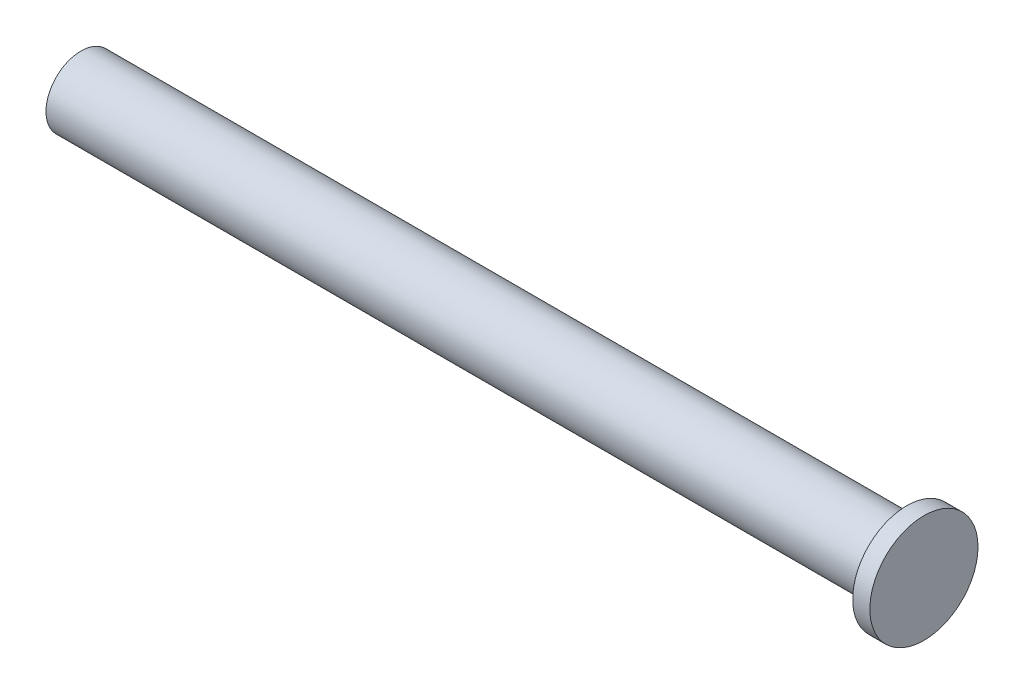
from build123d import *

# Parameters (mm, degrees)
SKETCH1_R           = 3.2258
BOSS_EXTRUDE1_DEPTH = 38.1
SKETCH2_R           = 4.989350209
BOSS_EXTRUDE2_DEPTH = 1.5875
SKETCH7_R           = 1.905
CUT_EXTRUDE1_DEPTH  = 12.7
THREAD1_PITCH       = 0.705555556


with BuildPart() as part:
    # Sketch1 → Boss-Extrude1 (new, symmetric)
    with BuildSketch(Plane(origin=(0, 0, 0), x_dir=(0, 0, -1), z_dir=(1, 0, 0))):
        with Locations(Location((0, 0, 0), (0, 0, 180))):
            Circle(SKETCH1_R)
    extrude(amount=BOSS_EXTRUDE1_DEPTH, both=True)

    # Sketch2 → Boss-Extrude2 (add)
    with BuildSketch(Plane(origin=(38.1, 0, 0), x_dir=(0, 0, -1), z_dir=(1, 0, 0))):
        Circle(SKETCH2_R)
    extrude(amount=BOSS_EXTRUDE2_DEPTH)

    # Sketch7 → Cut-Extrude1 (cut)
    with BuildSketch(Plane.ZY.offset(38.1)):
        Circle(SKETCH7_R)
    extrude(amount=-CUT_EXTRUDE1_DEPTH, mode=Mode.SUBTRACT)

    # Thread1: the profile of Thread Profile4 profile screwed along a right-hand helix of 18 turns, 6 arcs to a turn; built about Z, then put on its axis
    thread1_z = Axis((0, 0, 0), (0, 0, 1))
    thread1_corners = [(1.9047, 0, -0.000173205), (2.286893145, 1e-09, 0.22048611), (2.286893145, 1e-09, 0.308680555), (1.9047, 0, 0.52933987)]
    with BuildLine(mode=Mode.PRIVATE) as thread1_profile:
        Line(thread1_corners[0], thread1_corners[1])
        Line(thread1_corners[1], thread1_corners[2])
        Line(thread1_corners[2], thread1_corners[3])
        Line(thread1_corners[3], thread1_corners[0])
    thread1_cap = Face(thread1_profile.wire())
    thread1_turn_angles = [0, 30, 60, 90, 120, 150, 180, 210, 240, 270, 300, 330, 360]
    thread1_turn_weights = [1, 0.8660254037844387, 1, 0.8660254037844387, 1, 0.8660254037844387, 1, 0.8660254037844387, 1, 0.8660254037844387, 1, 0.8660254037844387, 1]
    thread1_turn_rails = [Edge.make_bspline([Vector(p[0], p[1], 0).rotate(thread1_z, thread1_turn_angles[k]) / thread1_turn_weights[k] + Vector(0, 0, p[2] + THREAD1_PITCH * thread1_turn_angles[k] / 360) for k in range(13)], [0, 0, 0, 1, 1, 2, 2, 3, 3, 4, 4, 5, 5, 6, 6, 6], 2, thread1_turn_weights) for p in thread1_corners]
    thread1_turn_sides = [Face.make_surface_from_curves(thread1_turn_rails[p[0]], thread1_turn_rails[p[1]]) for p in [(0, 1), (1, 2), (2, 3), (3, 0)]]
    thread1 = Plane(origin=(-25.4, 0, 0), x_dir=(0, 0.052335956, 0.998629535), z_dir=(-1, 0, 0)) * Solid(Shell([*[p.moved(Location((0, 0, THREAD1_PITCH * i))) for i in range(18) for p in thread1_turn_sides], thread1_cap, thread1_cap.rotate(thread1_z, 6480).moved(Location((0, 0, THREAD1_PITCH * 6480 / 360)))]))
    add(thread1, mode=Mode.SUBTRACT)


solid = part.part
